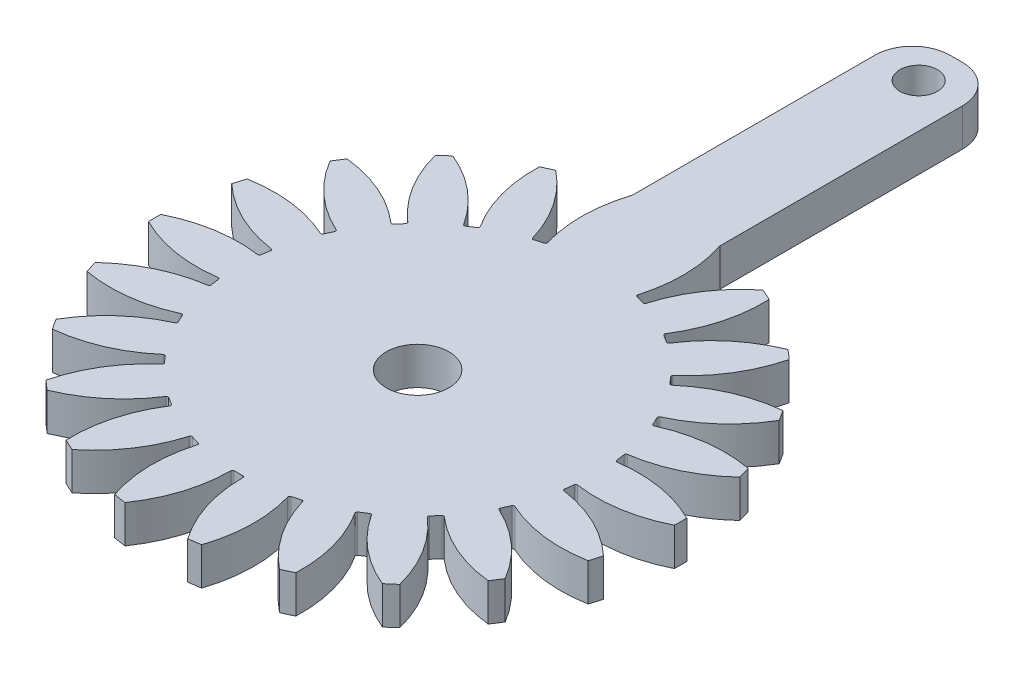
from build123d import *

# Parameters (mm, degrees)
SKETCH1_R               = 21
BOSS_EXTRUDE1_DEPTH     = 3
CUT_EXTRUDE1_DEPTH      = 30.849623113
CUT_EXTRUDE1_DEPTH_BACK = 30.849623113
SKETCH2_R               = 2.5
CUT_EXTRUDE2_DEPTH      = 30.849623113
CIRPATTERN1_COUNT       = 22
SKETCH4_W               = 7
SKETCH4_H               = 30.5
BOSS_EXTRUDE2_DEPTH     = 3
FILLET1_R               = 3
CUT_EXTRUDE3_DEPTH      = 48.947888379
CUT_EXTRUDE3_DEPTH_BACK = 48.947888379
SKETCH5_R               = 1.5


with BuildPart() as part:
    # Sketch1 → Boss-Extrude1 (new body)
    with BuildSketch(Plane(origin=(0, 0, 0), x_dir=(1, 0, 0), z_dir=(0, 1, 0))):
        Circle(SKETCH1_R)
    extrude(amount=BOSS_EXTRUDE1_DEPTH)

    # Sketch2 → Cut-Extrude1 (cut, two sides: drawn at the far end of the back side and taken through both)
    with BuildSketch(Plane(origin=(0, 3, 0), x_dir=(1, 0, 0), z_dir=(0, 1, 0)).offset(-CUT_EXTRUDE1_DEPTH_BACK)):
        Circle(SKETCH2_R)
    extrude(amount=CUT_EXTRUDE1_DEPTH + CUT_EXTRUDE1_DEPTH_BACK, mode=Mode.SUBTRACT)

    # Sketch3 → Cut-Extrude2 (cut, symmetric)
    with BuildSketch(Plane(origin=(0, 3, 0), x_dir=(1, 0, 0), z_dir=(0, 1, 0))):
        with BuildLine():
            Line((0.35, 14.3), (-0.35, 14.3))
            ThreePointArc((-0.35, 14.3), (-0.439436957, 14.337046001), (-0.476482958, 14.426482958))
            ThreePointArc((-0.476482958, 14.426482958), (-0.994323602, 17.794147764), (-2.5, 20.850659462))
            ThreePointArc((-2.5, 20.850659462), (0, 21), (2.5, 20.850659462))
            ThreePointArc((2.5, 20.850659462), (0.994323602, 17.794147764), (0.476482958, 14.426482958))
            ThreePointArc((0.476482958, 14.426482958), (0.439436957, 14.337046001), (0.35, 14.3))
        make_face()
    cut_extrude2 = extrude(amount=CUT_EXTRUDE2_DEPTH, both=True, mode=Mode.SUBTRACT)

    # CirPattern1: Cut-Extrude2 ×22 about axis
    cirpattern1_axis = Axis((0, 0, 0), (0, 1, 0))
    for i in range(1, CIRPATTERN1_COUNT):
        add(cut_extrude2.rotate(cirpattern1_axis, i * 360 / CIRPATTERN1_COUNT), mode=Mode.SUBTRACT)

    # Sketch4 → Boss-Extrude2 (add)
    with BuildSketch(Plane(origin=(0, 3, 0), x_dir=(1, 0, 0), z_dir=(0, 1, 0))):
        with Locations((0, 27.75)):
            Rectangle(SKETCH4_W, SKETCH4_H)
    extrude(amount=-BOSS_EXTRUDE2_DEPTH)

    # Fillet1
    fillet1_edges = [part.edges().sort_by_distance(p)[0] for p in [
        (3.5, 1.5, -43),
        (-3.5, 1.5, -43),
    ]]
    fillet(fillet1_edges, radius=FILLET1_R)

    # Sketch5 → Cut-Extrude3 (cut, two sides: drawn at the far end of the back side and taken through both)
    with BuildSketch(Plane(origin=(0, 3, 0), x_dir=(1, 0, 0), z_dir=(0, 1, 0)).offset(-CUT_EXTRUDE3_DEPTH_BACK)):
        with Locations((0, 40)):
            Circle(SKETCH5_R)
    extrude(amount=CUT_EXTRUDE3_DEPTH + CUT_EXTRUDE3_DEPTH_BACK, mode=Mode.SUBTRACT)


solid = part.part
